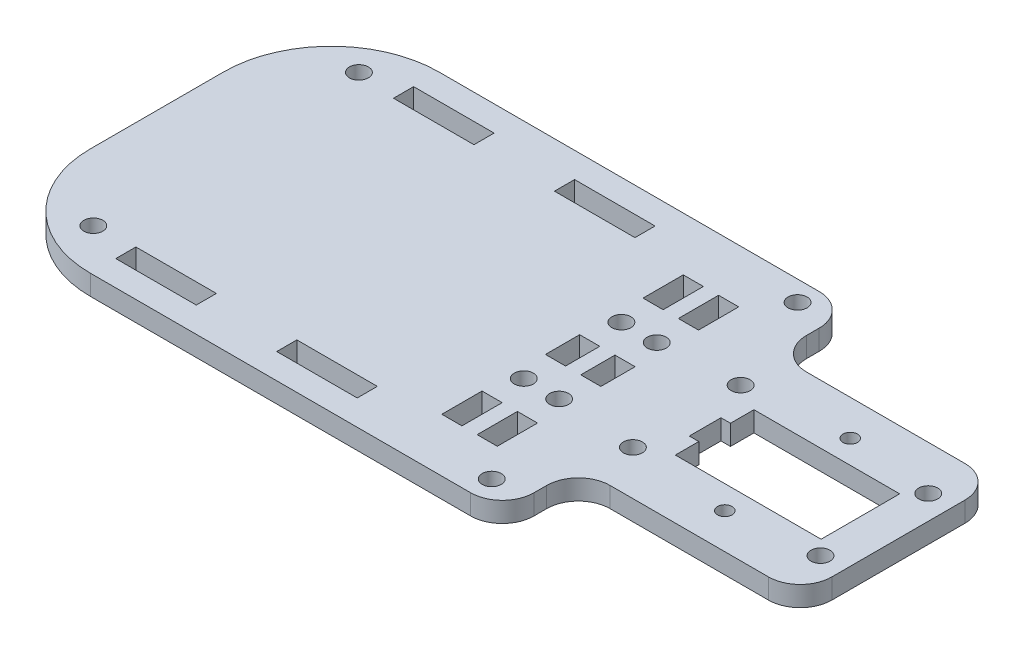
from build123d import *

# Parameters (mm, degrees)
SKETCH1_R           = 1.5
SKETCH1_R_2         = 1.15
SKETCH1_R_3         = 1.4999
SKETCH1_R_4         = 1.499900003
SKETCH1_W           = 3.175
SKETCH1_H           = 6.35
SKETCH1_H_2         = 5.4
SKETCH1_W_2         = 12.7
SKETCH1_H_3         = 3.175
BOSS_EXTRUDE1_DEPTH = 3.175


with BuildPart() as part:
    # Sketch1 → Boss-Extrude1 (new body)
    with BuildSketch(Plane(origin=(0, 0, 0), x_dir=(1, 0, 0), z_dir=(0, 1, 0))):
        with BuildLine():
            Line((17, 0), (77, 0))
            ThreePointArc((77, 0), (80.535533906, 1.464466094), (82, 5))
            Line((82, 5), (82, 7))
            ThreePointArc((82, 7), (83.464466094, 10.535533906), (87, 12))
            Line((87, 12), (112, 12))
            ThreePointArc((112, 12), (115.535533906, 13.464466094), (117, 17))
            Line((117, 17), (117, 38))
            ThreePointArc((117, 38), (115.535533906, 41.535533906), (112, 43))
            Line((112, 43), (87, 43))
            ThreePointArc((87, 43), (83.464466094, 44.464466094), (82, 48))
            Line((82, 48), (82, 50))
            ThreePointArc((82, 50), (80.535533906, 53.535533906), (77, 55))
            Line((77, 55), (17, 55))
            ThreePointArc((17, 55), (4.97918472, 50.02081528), (0, 38))
            Line((0, 38), (0, 17))
            ThreePointArc((0, 17), (4.97918472, 4.97918472), (17, 0))
        make_face()
        with Locations((65.5875, 35.2)):
            Circle(SKETCH1_R, mode=Mode.SUBTRACT)
        with Locations((71.1625, 35.2)):
            Circle(SKETCH1_R, mode=Mode.SUBTRACT)
        with Locations((65.5875, 19.8)):
            Circle(SKETCH1_R, mode=Mode.SUBTRACT)
        with Locations((71.1625, 19.8)):
            Circle(SKETCH1_R, mode=Mode.SUBTRACT)
        with Locations((10.73981072, 48.62727462)):
            Circle(SKETCH1_R, mode=Mode.SUBTRACT)
        with Locations((10.73981072, 6.71727462)):
            Circle(SKETCH1_R, mode=Mode.SUBTRACT)
        with Locations((76.77981072, 3.54227462)):
            Circle(SKETCH1_R, mode=Mode.SUBTRACT)
        with Locations((76.77981072, 51.80227462)):
            Circle(SKETCH1_R, mode=Mode.SUBTRACT)
        with Locations((83.6, 36)):
            Circle(SKETCH1_R, mode=Mode.SUBTRACT)
        with Locations((99.5, 37.4)):
            Circle(SKETCH1_R_2, mode=Mode.SUBTRACT)
        with Locations((99.5, 17.6)):
            Circle(SKETCH1_R_2, mode=Mode.SUBTRACT)
        with Locations((83.6, 19)):
            Circle(SKETCH1_R_3, mode=Mode.SUBTRACT)
        with Locations((113.2, 19)):
            Circle(SKETCH1_R_4, mode=Mode.SUBTRACT)
        with Locations((113.2, 36)):
            Circle(SKETCH1_R_4, mode=Mode.SUBTRACT)
        with Locations((65.5875, 43.375)):
            Rectangle(SKETCH1_W, SKETCH1_H, mode=Mode.SUBTRACT)
        with Locations((65.5875, 11.625)):
            Rectangle(SKETCH1_W, SKETCH1_H, mode=Mode.SUBTRACT)
        with Locations((65.5875, 27.5)):
            Rectangle(SKETCH1_W, SKETCH1_H_2, mode=Mode.SUBTRACT)
        with Locations((71.1625, 43.375)):
            Rectangle(SKETCH1_W, SKETCH1_H, mode=Mode.SUBTRACT)
        with Locations((71.1625, 27.5)):
            Rectangle(SKETCH1_W, SKETCH1_H_2, mode=Mode.SUBTRACT)
        with Locations((71.1625, 11.625)):
            Rectangle(SKETCH1_W, SKETCH1_H, mode=Mode.SUBTRACT)
        with Locations((48.75, 5.5875)):
            Rectangle(SKETCH1_W_2, SKETCH1_H_3, mode=Mode.SUBTRACT)
        with Locations((23.35, 49.4125)):
            Rectangle(SKETCH1_W_2, SKETCH1_H_3, mode=Mode.SUBTRACT)
        with Locations((48.75, 49.4125)):
            Rectangle(SKETCH1_W_2, SKETCH1_H_3, mode=Mode.SUBTRACT)
        with Locations((23.35, 5.5875)):
            Rectangle(SKETCH1_W_2, SKETCH1_H_3, mode=Mode.SUBTRACT)
        Polygon((88, 33.7), (111, 33.7), (111, 21.3), (88, 21.3), (88, 25), (86.5, 25), (86.5, 30), (88, 30), align=None, mode=Mode.SUBTRACT)
    extrude(amount=BOSS_EXTRUDE1_DEPTH)


solid = part.part
